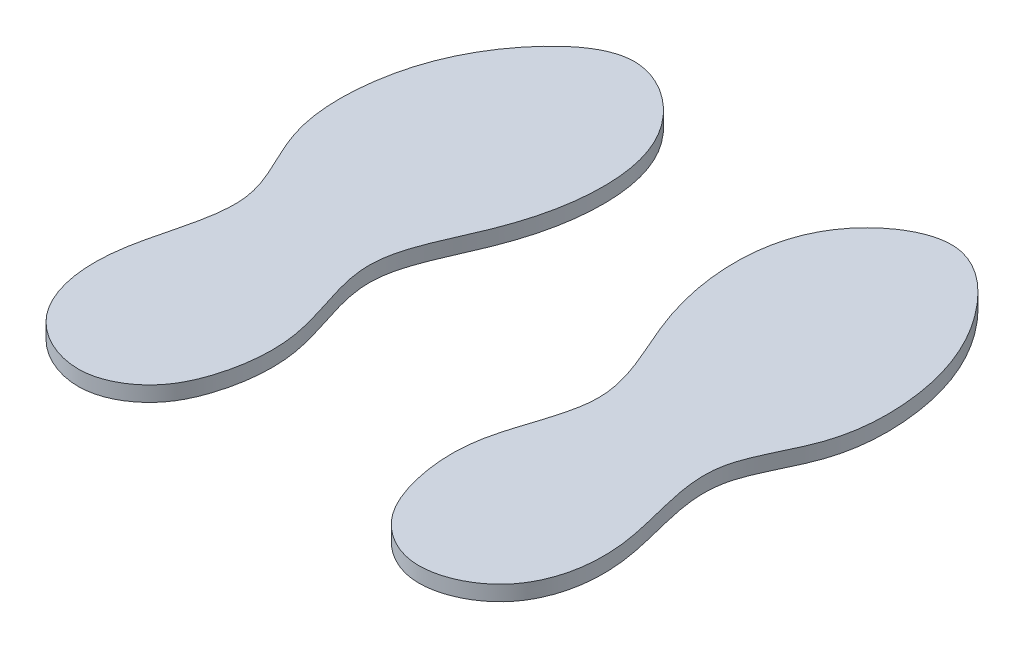
from build123d import *

# Parameters (mm, degrees)
BOSS_EXTRUDE4_DEPTH   = 10
BOSS_EXTRUDE4_2_DEPTH = 10


with BuildPart() as part:
    # Sketch4 → Boss-Extrude4 (new body)
    with BuildSketch(Plane(origin=(0, 0, 0), x_dir=(1, 0, 0), z_dir=(0, 1, 0))):
        with BuildLine():
            add(Edge.make_bspline(
                [(106.544097631, 392.449119023), (122.658150077, 391.466501961), (161.174594343, 358.166552057), (182.82392291, 300.142147188), (179.371588261, 236.959772497), (143.32218801, 183.773719871), (170.286769279, 125.556087092), (167.436859462, 76.340355288), (147.656228747, 42.946319599), (109.875408578, 26.315110761), (74.554843466, 48.635410805), (59.741237181, 83.871043916), (56.202256601, 132.581501852), (86.901930064, 189.336253955), (54.252894308, 247.024201151), (39.399948672, 305.112339134), (48.670414959, 365.596312938), (88.98808942, 393.51966495), (106.544097631, 392.449119023)],
                knots=[0, 0, 0, 0, 0.06070552, 0.156337144, 0.218930963, 0.279880895, 0.369614909, 0.425901175, 0.449068035, 0.506702922, 0.548647895, 0.583423384, 0.640397757, 0.718760148, 0.793011406, 0.859143312, 0.933862285, 1, 1, 1, 1], degree=3))
        make_face()
    extrude(amount=BOSS_EXTRUDE4_DEPTH)


with BuildPart() as body_2:
    # Sketch4 → Boss-Extrude4 2 (new body)
    with BuildSketch(Plane(origin=(0, 0, 0), x_dir=(1, 0, 0), z_dir=(0, 1, 0))):
        with BuildLine():
            add(Edge.make_bspline(
                [(-106.544097631, 392.449119023), (-122.658150077, 391.466501961), (-161.174594343, 358.166552057), (-182.82392291, 300.142147188), (-179.371588261, 236.959772497), (-143.32218801, 183.773719871), (-170.286769279, 125.556087092), (-167.436859462, 76.340355288), (-147.656228747, 42.946319599), (-109.875408578, 26.315110761), (-74.554843466, 48.635410805), (-59.741237181, 83.871043916), (-56.202256601, 132.581501852), (-86.901930064, 189.336253955), (-54.252894308, 247.024201151), (-39.399948672, 305.112339134), (-48.670414959, 365.596312938), (-88.98808942, 393.51966495), (-106.544097631, 392.449119023)],
                knots=[0, 0, 0, 0, 0.06070552, 0.156337144, 0.218930963, 0.279880895, 0.369614909, 0.425901175, 0.449068035, 0.506702922, 0.548647895, 0.583423384, 0.640397757, 0.718760148, 0.793011406, 0.859143312, 0.933862285, 1, 1, 1, 1], degree=3))
        make_face()
    extrude(amount=BOSS_EXTRUDE4_2_DEPTH)


solid = Compound([part.part, body_2.part])
